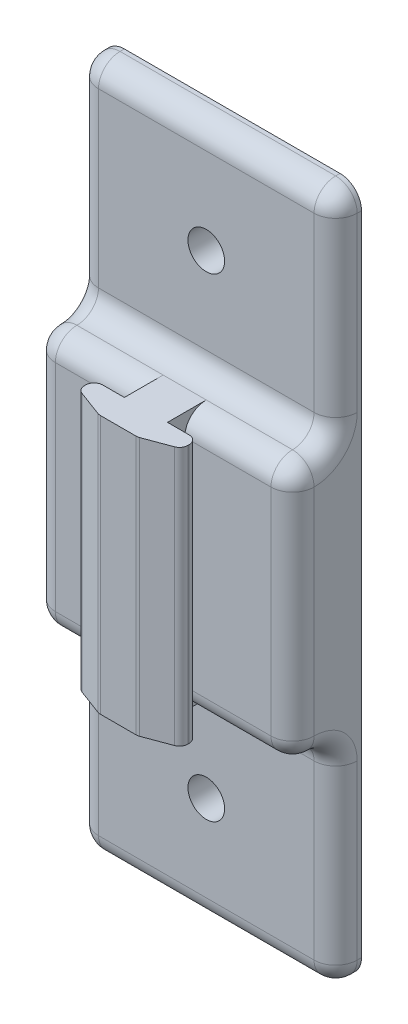
from build123d import *

# Parameters (mm, degrees)
ESQUISSE1_W             = 30
ESQUISSE1_H             = 80
BOSS_EXTRU_1_DEPTH      = 3
ESQUISSE2_R             = 2.125
ENL_V_MAT_EXTRU_1_DEPTH = 3
ESQUISSE3_W             = 30
ESQUISSE3_H             = 30
BOSS_EXTRU_2_DEPTH      = 5
BOSS_EXTRU_3_DEPTH      = 30
CONG_1_R                = 1
CONG_2_R                = 2.5


with BuildPart() as part:
    # Esquisse1 → Boss.-Extru.1 (new body)
    with BuildSketch(Plane.XY):
        with Locations((15, 40)):
            Rectangle(ESQUISSE1_W, ESQUISSE1_H)
    extrude(amount=BOSS_EXTRU_1_DEPTH)

    # Esquisse2 → Enlèv. mat.-Extru.1 (cut)
    with BuildSketch(Plane.XY.offset(3)):
        with Locations((15, 67.5)):
            Circle(ESQUISSE2_R)
        with Locations((15, 12.5)):
            Circle(ESQUISSE2_R)
    extrude(amount=-ENL_V_MAT_EXTRU_1_DEPTH, mode=Mode.SUBTRACT)

    # Esquisse3 → Boss.-Extru.2 (add)
    with BuildSketch(Plane.XY.offset(3)):
        with Locations((15, 40)):
            Rectangle(ESQUISSE3_W, ESQUISSE3_H)
    extrude(amount=BOSS_EXTRU_2_DEPTH)

    # Esquisse4 → Boss.-Extru.3 (add)
    with BuildSketch(Plane(origin=(0, 25, 0), x_dir=(-1, 0, 0), z_dir=(0, -1, 0))):
        Polygon((-12.5, -8), (-12.5, -10), (-9, -10), (-9, -11.81), (-12.75, -13.201941091), (-17.25, -13.201941091), (-21, -11.81), (-21, -10), (-17.5, -10), (-17.5, -8), align=None)
    extrude(amount=-BOSS_EXTRU_3_DEPTH)

    # Congé1
    cong_1_edges = [part.edges().sort_by_distance(p)[0] for p in [
        (9, 40, 10),
        (9, 40, 11.81),
        (12.75, 40, 13.201941091),
        (17.25, 40, 13.201941091),
        (21, 40, 11.81),
        (21, 40, 10),
    ]]
    fillet(cong_1_edges, radius=CONG_1_R)

    # Congé2
    cong_2_edges = [part.edges().sort_by_distance(p)[0] for p in [
        (15, 55, 3),
        (15, 25, 3),
    ]]
    fillet(cong_2_edges, radius=CONG_2_R)
    cong_2_2_edges = [part.edges().sort_by_distance(p)[0] for p in [
        (0, 0, 1.5),
        (30, 40, 8),
        (0, 40, 8),
        (30, 80, 1.5),
        (0, 80, 1.5),
        (15, 80, 3),
        (30, 68.75, 3),
        (0, 68.75, 3),
        (30, 0, 1.5),
        (15, 0, 3),
        (0, 11.25, 3),
        (30, 11.25, 3),
        (23.75, 25, 8),
        (6.25, 25, 8),
        (23.75, 55, 8),
        (6.25, 55, 8),
        (30, 24.267766953, 3.732233047),
        (0, 24.267766953, 3.732233047),
        (0, 55.732233047, 3.732233047),
        (30, 55.732233047, 3.732233047),
    ]]
    fillet(cong_2_2_edges, radius=CONG_2_R - 0.0001)  # a hair under: the kernel refuses the full size


solid = part.part
